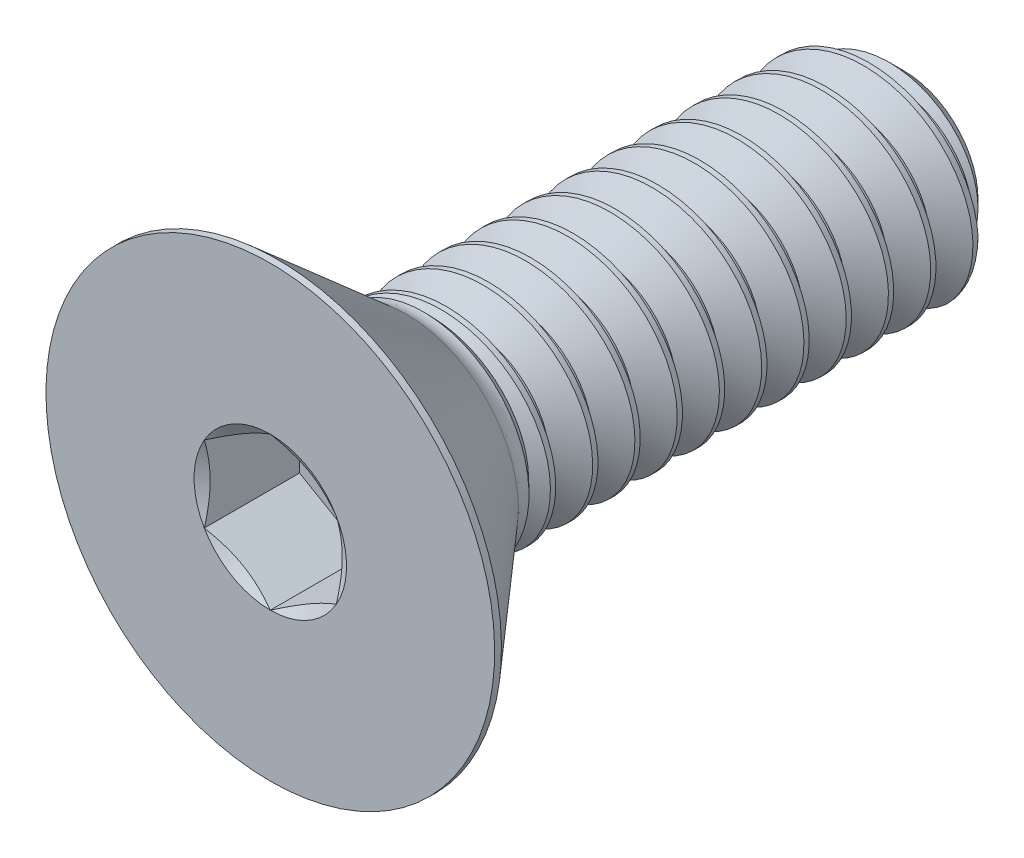
from build123d import *

# Parameters (mm, degrees)
SKETCH1_W          = 19.05
SKETCH1_H          = 3.175
CHAMFER1_SIZE      = 0.9525
CUT_SWEEP1_PITCH   = 1.27
CUT_EXTRUDE2_DEPTH = 2.86258


with BuildPart() as part:
    # Sketch1 → Revolve1 (revolve)
    with BuildSketch(Plane(origin=(0, 0, 0), x_dir=(0, 0, -1), z_dir=(1, 0, 0))):
        with Locations((9.525, 1.5875)):
            Rectangle(SKETCH1_W, SKETCH1_H)
    revolve(axis=Axis((0, 0, -19.05), (0, 0, 1)))

    # Chamfer1
    chamfer1_edges = [part.edges().sort_by_distance(p)[0] for p in [
        (0, -3.175, -19.05),
    ]]
    chamfer(chamfer1_edges, length=CHAMFER1_SIZE)

    # Cut-Sweep1: the profile of Sketch2 profile screwed along a right-hand helix of 15 turns, 8 arcs to a turn; built about Z, then put on its axis
    cut_sweep1_z = Axis((0, 0, 0), (0, 0, 1))
    cut_sweep1_corners = [(3.1756, 0, 0.00034641), (3.1756, 0, -1.11159641), (2.350110803, 0, -0.635), (2.350110803, 0, -0.47625)]
    with BuildLine(mode=Mode.PRIVATE) as cut_sweep1_profile:
        Line(cut_sweep1_corners[0], cut_sweep1_corners[1])
        Line(cut_sweep1_corners[1], cut_sweep1_corners[2])
        Line(cut_sweep1_corners[2], cut_sweep1_corners[3])
        Line(cut_sweep1_corners[3], cut_sweep1_corners[0])
    cut_sweep1_cap = Face(cut_sweep1_profile.wire())
    cut_sweep1_turn_angles = [0, 22.5, 45, 67.5, 90, 112.5, 135, 157.5, 180, 202.5, 225, 247.5, 270, 292.5, 315, 337.5, 360]
    cut_sweep1_turn_weights = [1, 0.9238795325112867, 1, 0.9238795325112867, 1, 0.9238795325112867, 1, 0.9238795325112867, 1, 0.9238795325112867, 1, 0.9238795325112867, 1, 0.9238795325112867, 1, 0.9238795325112867, 1]
    cut_sweep1_turn_rails = [Edge.make_bspline([Vector(p[0], p[1], 0).rotate(cut_sweep1_z, cut_sweep1_turn_angles[k]) / cut_sweep1_turn_weights[k] + Vector(0, 0, p[2] + CUT_SWEEP1_PITCH * cut_sweep1_turn_angles[k] / 360) for k in range(17)], [0, 0, 0, 1, 1, 2, 2, 3, 3, 4, 4, 5, 5, 6, 6, 7, 7, 8, 8, 8], 2, cut_sweep1_turn_weights) for p in cut_sweep1_corners]
    cut_sweep1_turn_sides = [Face.make_surface_from_curves(cut_sweep1_turn_rails[p[0]], cut_sweep1_turn_rails[p[1]]) for p in [(0, 1), (1, 2), (2, 3), (3, 0)]]
    cut_sweep1 = Plane(origin=(0, 0, -19.05), x_dir=(0, 1, 0), z_dir=(0, 0, 1)) * Solid(Shell([*[p.moved(Location((0, 0, CUT_SWEEP1_PITCH * i))) for i in range(15) for p in cut_sweep1_turn_sides], cut_sweep1_cap, cut_sweep1_cap.rotate(cut_sweep1_z, 5400).moved(Location((0, 0, CUT_SWEEP1_PITCH * 5400 / 360)))]))
    add(cut_sweep1, mode=Mode.SUBTRACT)

    # Sketch7 → Revolve2 (revolve)
    with BuildSketch(Plane(origin=(0, 0, 0), x_dir=(0, 0, -1), z_dir=(1, 0, 0)), mode=Mode.PRIVATE) as revolve2_sk:
        with BuildLine():
            Line((0, 6.7437), (0.20447, 6.7437))
            Line((0.20447, 6.7437), (4.0894, 3.366581874))
            ThreePointArc((4.0894, 3.366581874), (4.328282675, 3.224461616), (4.601808997, 3.175))
            Line((4.601808997, 3.175), (4.601808997, 0))
            Line((4.601808997, 0), (0, 0))
            Line((0, 0), (0, 6.7437))
        make_face()
    revolve(revolve2_sk.sketch.rotate(Axis((0, 0, 0), (0, 0, -1)), 189.052465709), axis=Axis((0, 0, 0), (0, 0, -1)))

    # Boss-Extrude1 cone 1 section (through the dimple's axis) → Boss-Extrude1 (revolve)
    with BuildSketch(Plane(origin=(0, 0, -4.601808997), x_dir=(0, -1, 0), z_dir=(1, 0, 0))):
        Polygon((0, 0), (3.175, 0), (0, 3.06606186), align=None)
    revolve(axis=Axis((0, 0, -4.601808997), (0, 0, -1)))

    # Sketch5 → Cut-Extrude2 (cut)
    with BuildSketch(Plane.XY):
        Polygon((0, 2.291358881), (-1.984375, 1.14567944), (-1.984375, -1.14567944), (0, -2.291358881), (1.984375, -1.14567944), (1.984375, 1.14567944), align=None)
    extrude(amount=-CUT_EXTRUDE2_DEPTH, mode=Mode.SUBTRACT)

    # Cut-Extrude3 cone 1 section (through the dimple's axis) → Cut-Extrude3 (revolve, cut)
    with BuildSketch(Plane(origin=(0, 0, 0), x_dir=(0, -1, 0), z_dir=(1, 0, 0))):
        Polygon((0, 0), (2.291358881, 0), (0, 1.322916667), align=None)
    revolve(axis=Axis((0, 0, 0), (0, 0, -1)), mode=Mode.SUBTRACT)


solid = part.part
